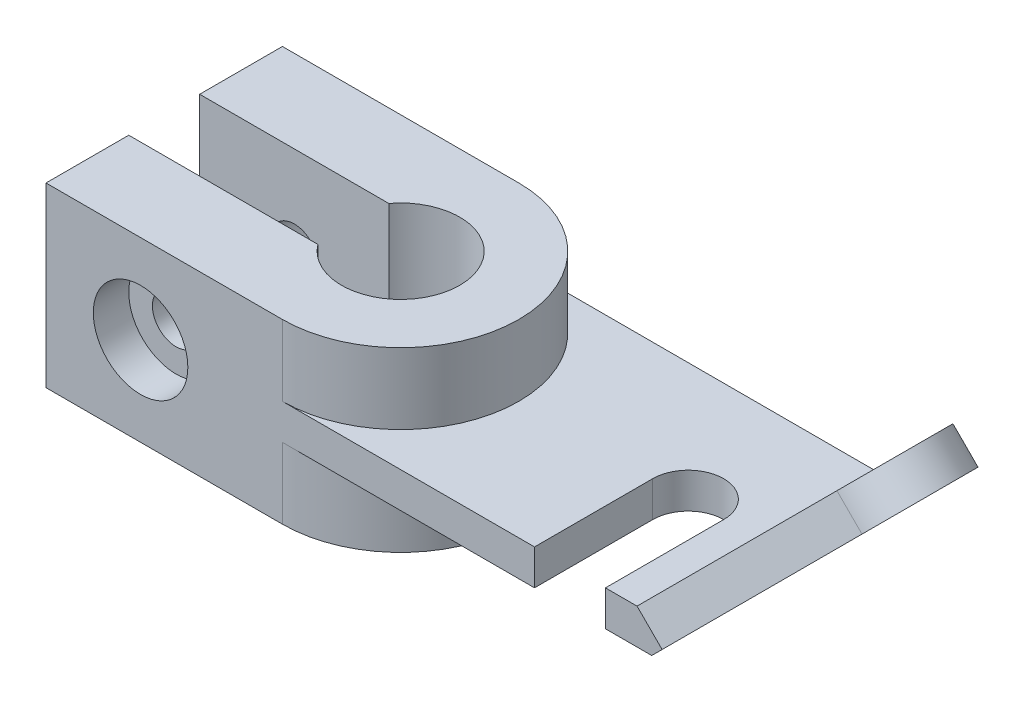
from build123d import *

# Parameters (mm, degrees)
BOSS_EXTRUDE1_DEPTH                                  = 45
CBORE_FOR_M24_HEX_SOCKET_HEAD_CAP_SCREW1_D           = 12
CBORE_FOR_M24_HEX_SOCKET_HEAD_CAP_SCREW1_DEPTH       = 21
CBORE_FOR_M24_HEX_SOCKET_HEAD_CAP_SCREW1_CBORE_D     = 24
CBORE_FOR_M24_HEX_SOCKET_HEAD_CAP_SCREW1_CBORE_DEPTH = 9
BOSS_EXTRUDE2_DEPTH                                  = 4.5
BOSS_EXTRUDE3_DEPTH                                  = 9
SKETCH7_W                                            = 60
SKETCH7_H                                            = 9
BOSS_EXTRUDE4_DEPTH                                  = 9
CUT_EXTRUDE2_START                                   = -60
CUT_EXTRUDE2_DEPTH                                   = 60
SKETCH9_R                                            = 7.5
CUT_EXTRUDE3_DEPTH                                   = 151.324191827
CUT_EXTRUDE4_DEPTH                                   = 149.198401551


# Read off the part's stored shape, not the designer's step: Cut-Extrude2
with BuildPart() as part:
    # Sketch1 → Boss-Extrude1 (new body)
    with BuildSketch(Plane(origin=(0, 0, 0), x_dir=(1, 0, 0), z_dir=(0, 1, 0))):
        with BuildLine():
            Line((0, -30), (-60, -30))
            Line((-60, -30), (-60, -9))
            Line((-60, -9), (-12, -9))
            ThreePointArc((-12, -9), (15, 0), (-12, 9))
            Line((-12, 9), (-60, 9))
            Line((-60, 9), (-60, 30))
            Line((-60, 30), (0, 30))
            ThreePointArc((0, 30), (30, 0), (0, -30))
        make_face()
    extrude(amount=BOSS_EXTRUDE1_DEPTH)

    # CBORE for M24 Hex Socket Head Cap Screw1
    with Locations(Plane.XY.offset(30)):
        with Locations((-36, 22.5)):
            cbore_for_m24_hex_socket_head_cap_screw1 = CounterBoreHole(CBORE_FOR_M24_HEX_SOCKET_HEAD_CAP_SCREW1_D / 2, CBORE_FOR_M24_HEX_SOCKET_HEAD_CAP_SCREW1_CBORE_D / 2, CBORE_FOR_M24_HEX_SOCKET_HEAD_CAP_SCREW1_CBORE_DEPTH, depth=CBORE_FOR_M24_HEX_SOCKET_HEAD_CAP_SCREW1_DEPTH)

    # Mirror1: CBORE for M24 Hex Socket Head Cap Screw1 across plane
    add(cbore_for_m24_hex_socket_head_cap_screw1.mirror(Plane.XY), mode=Mode.SUBTRACT)

    # Sketch4 → Boss-Extrude2 (add, symmetric)
    with BuildSketch(Plane(origin=(0, 22.5, 0), x_dir=(1, 0, 0), z_dir=(0, 1, 0))):
        with BuildLine():
            Line((0, 30), (90, 30))
            Line((90, 30), (90, -30))
            Line((90, -30), (0, -30))
            ThreePointArc((0, -30), (30, 0), (0, 30))
        make_face()
    extrude(amount=BOSS_EXTRUDE2_DEPTH, both=True)



with BuildPart() as body_2:
    # Sketch6 → Boss-Extrude3 (new body)
    with BuildSketch(Plane(origin=(31.5, -31.5, 0), x_dir=(0.7071067811865462, 0.7071067811865489, 0), z_dir=(0.7071067811865489, -0.7071067811865462, 0))):
        with BuildLine():
            Line((82.731493399, 30), (82.731493399, -30))
            Line((82.731493399, -30), (132.264035588, -14.298813283))
            ThreePointArc((132.264035588, -14.298813283), (142.731493399, 0), (132.264035588, 14.298813283))
            Line((132.264035588, 14.298813283), (82.731493399, 30))
        make_face()
    extrude(amount=BOSS_EXTRUDE3_DEPTH)


with BuildPart() as part_1:
    add(part.part)

    add(body_2.part)  # Boss-Extrude4 merges body 2
    # Sketch7 → Boss-Extrude4 (add)
    with BuildSketch(Plane(origin=(58.5, 58.5, 0), x_dir=(0, 0, 1), z_dir=(-0.7071067811865462, -0.7071067811865488, 0))):
        with Locations((0, -49.047727215)):
            Rectangle(SKETCH7_W, SKETCH7_H)
    extrude(amount=BOSS_EXTRUDE4_DEPTH)

    # Cut-Extrude2 outline → Cut-Extrude2 (cut)
    with BuildSketch(Plane.XY.offset(30).offset(CUT_EXTRUDE2_START)):
        Polygon((90, 14.272077939), (93.727922061, 18), (86.272077939, 18), align=None)
    extrude(amount=CUT_EXTRUDE2_DEPTH, mode=Mode.SUBTRACT)

    # Sketch9 → Cut-Extrude3 (cut, through all)
    with BuildSketch(Plane(origin=(31.5, -31.5, 0), x_dir=(0, 0, 1), z_dir=(-0.7071067811865488, 0.7071067811865464, 0))):
        with Locations(Location((0, 127.731493399, 0), (0, 0, 270))):
            Circle(SKETCH9_R)
    extrude(amount=-CUT_EXTRUDE3_DEPTH, mode=Mode.SUBTRACT)

    # Sketch10 → Cut-Extrude4 (cut, through all)
    with BuildSketch(Plane(origin=(0, 27, 0), x_dir=(1, 0, 0), z_dir=(0, 1, 0))):
        with BuildLine():
            ThreePointArc((81.979848708, 0), (72.979848708, 9), (63.979848708, 0))
            Line((63.979848708, 0), (63.979848708, -30))
            Line((63.979848708, -30), (81.979848708, -30))
            Line((81.979848708, -30), (81.979848708, 0))
        make_face()
    extrude(amount=-CUT_EXTRUDE4_DEPTH, mode=Mode.SUBTRACT)


solid = part_1.part
